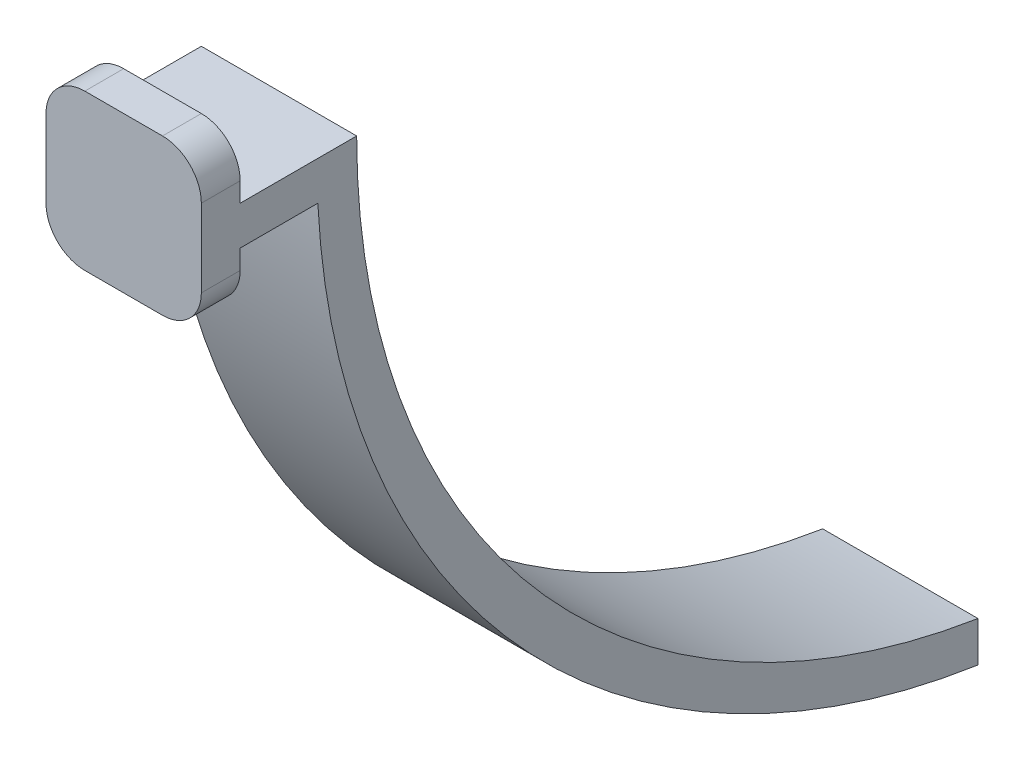
from build123d import *

# Parameters (mm, degrees)
BOSS_EXTRUDE1_DEPTH = 12.7
FILLET2_R           = 6.35


with BuildPart() as part:
    # Sketch1 → Boss-Extrude1 (new, symmetric)
    with BuildSketch(Plane(origin=(0, 0, 0), x_dir=(0, 0, -1), z_dir=(1, 0, 0))):
        with BuildLine():
            Line((0, 0), (0, 25.4))
            Line((0, 25.4), (6.35, 25.4))
            Line((6.35, 25.4), (6.35, 15.875))
            Line((6.35, 15.875), (25.4, 15.875))
            ThreePointArc((25.4, 15.875), (54.249114928, -62.413057838), (127, -103.2615603))
            Line((127, -103.2615603), (127, -109.848585695))
            ThreePointArc((127, -109.848585695), (51.735823624, -69.413678232), (19.05, 9.525))
            Line((19.05, 9.525), (6.35, 9.525))
            Line((6.35, 9.525), (6.35, 0))
            Line((6.35, 0), (0, 0))
        make_face()
    extrude(amount=BOSS_EXTRUDE1_DEPTH, both=True)

    # Fillet2
    fillet2_edges = [part.edges().sort_by_distance(p)[0] for p in [
        (-12.7, 0, -3.175),
        (12.7, 0, -3.175),
        (12.7, 25.4, -3.175),
        (-12.7, 25.4, -3.175),
    ]]
    fillet(fillet2_edges, radius=FILLET2_R)


solid = part.part
